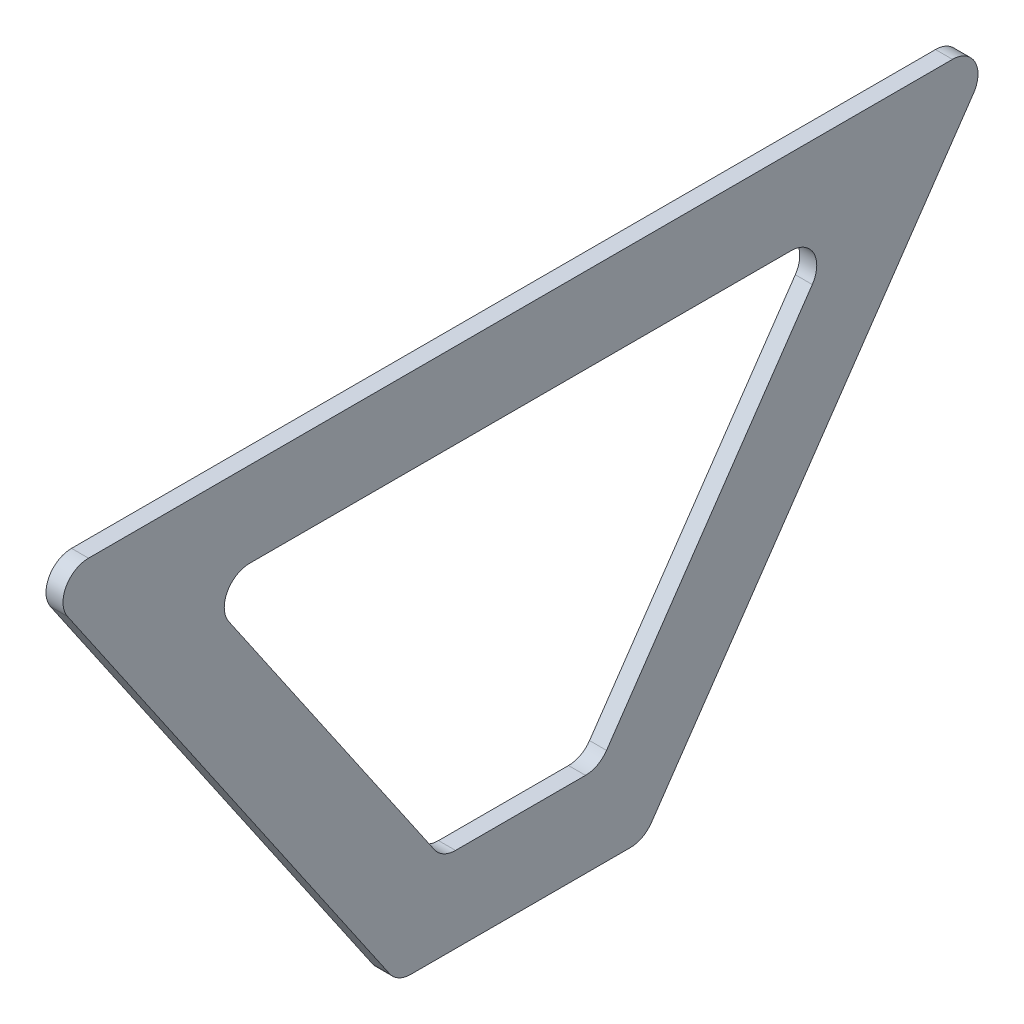
from build123d import *

# Parameters (mm, degrees)
BASE_FLANGE1_DEPTH = 2
FILLET1_R          = 3


# Sheet-metal steps are written as plain solids
with BuildPart() as part:
    # Sketch1 → Base-Flange1 (new body)
    with BuildSketch(Plane(origin=(0, 0, 0), x_dir=(0, 0, -1), z_dir=(1, 0, 0))):
        Polygon((-14.5, -22.025862069), (14.5, -22.025862069), (56.5, 39.324712644), (-56.5, 39.324712644), align=None)
        Polygon((-9.227058078, -12.025862069), (9.227058078, -12.025862069), (37.5352548, 29.324712644), (-37.5352548, 29.324712644), align=None, mode=Mode.SUBTRACT)
    extrude(amount=-BASE_FLANGE1_DEPTH)

    # Fillet1
    fillet1_edges = [part.edges().sort_by_distance(p)[0] for p in [
        (-1, 29.324712644, -37.5352548),
        (-1, -12.025862069, -9.227058078),
        (-1, -12.025862069, 9.227058078),
        (-1, 29.324712644, 37.5352548),
        (-1, -22.025862069, -14.5),
        (-1, -22.025862069, 14.5),
        (-1, 39.324712644, 56.5),
        (-1, 39.324712644, -56.5),
    ]]
    fillet(fillet1_edges, radius=FILLET1_R)


solid = part.part
